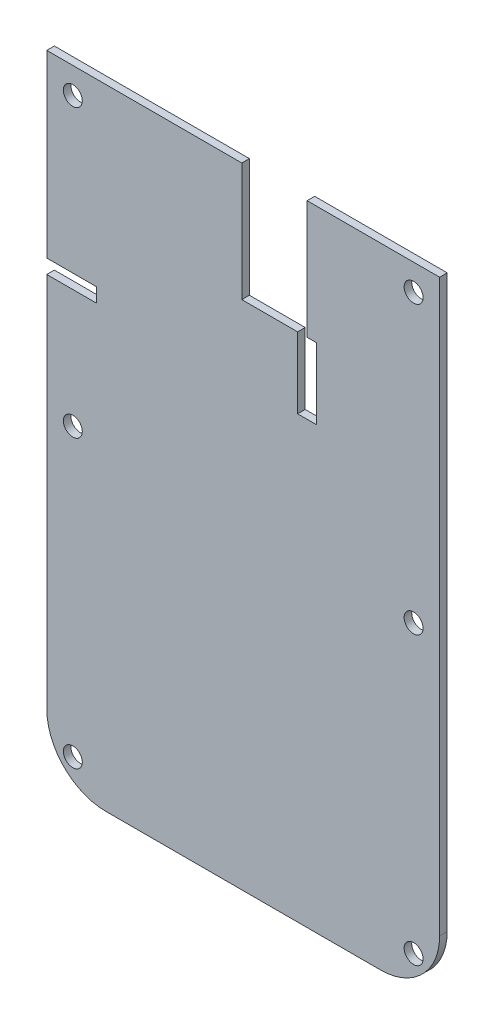
from build123d import *

# Parameters (mm, degrees)
EXTRUDE_1_DEPTH     = 0.8
SKETCH_2_R          = 1
SKETCH_2_W          = 5.25
SKETCH_2_H          = 1.5
SKETCH_2_W_2        = 2
SKETCH_2_H_2        = 7.5
CUT_EXTRUDE_1_DEPTH = 79.390943354
SKETCH_3_W          = 6.9
SKETCH_3_H          = 12.5
CUT_EXTRUDE_2_DEPTH = 79.390943354


with BuildPart() as part:
    # 草图1 → 凸台-拉伸1 (new body)
    with BuildSketch(Plane.XY):
        with BuildLine():
            Line((-41.5, 66.5), (0, 66.5))
            Line((0, 66.5), (0, 6.25))
            ThreePointArc((0, 6.25), (-1.830582618, 1.830582618), (-6.25, 0))
            Line((-6.25, 0), (-35.25, 0))
            ThreePointArc((-35.25, 0), (-39.669417382, 1.830582618), (-41.5, 6.25))
            Line((-41.5, 6.25), (-41.5, 66.5))
        make_face()
    extrude(amount=EXTRUDE_1_DEPTH)

    # 草图2 → 切除-拉伸1 (cut, through all)
    with BuildSketch(Plane.XY.offset(0.8)):
        with Locations((-38.75, 63.75)):
            Circle(SKETCH_2_R)
        with Locations((-38.75, 33.5)):
            Circle(SKETCH_2_R)
        with Locations((-38.75, 3.25)):
            Circle(SKETCH_2_R)
        with Locations((-2.75, 3.25)):
            Circle(SKETCH_2_R)
        with Locations((-2.75, 33.5)):
            Circle(SKETCH_2_R)
        with Locations((-2.75, 63.75)):
            Circle(SKETCH_2_R)
        with Locations((-38.875, 46.75)):
            Rectangle(SKETCH_2_W, SKETCH_2_H)
        with Locations((-14, 50.25)):
            Rectangle(SKETCH_2_W_2, SKETCH_2_H_2)
    extrude(amount=-CUT_EXTRUDE_1_DEPTH, mode=Mode.SUBTRACT)

    # 草图3 → 切除-拉伸2 (cut, through all)
    with BuildSketch(Plane.XY.offset(0.8)):
        with Locations((-17.45, 60.25)):
            Rectangle(SKETCH_3_W, SKETCH_3_H)
    extrude(amount=-CUT_EXTRUDE_2_DEPTH, mode=Mode.SUBTRACT)


solid = part.part
